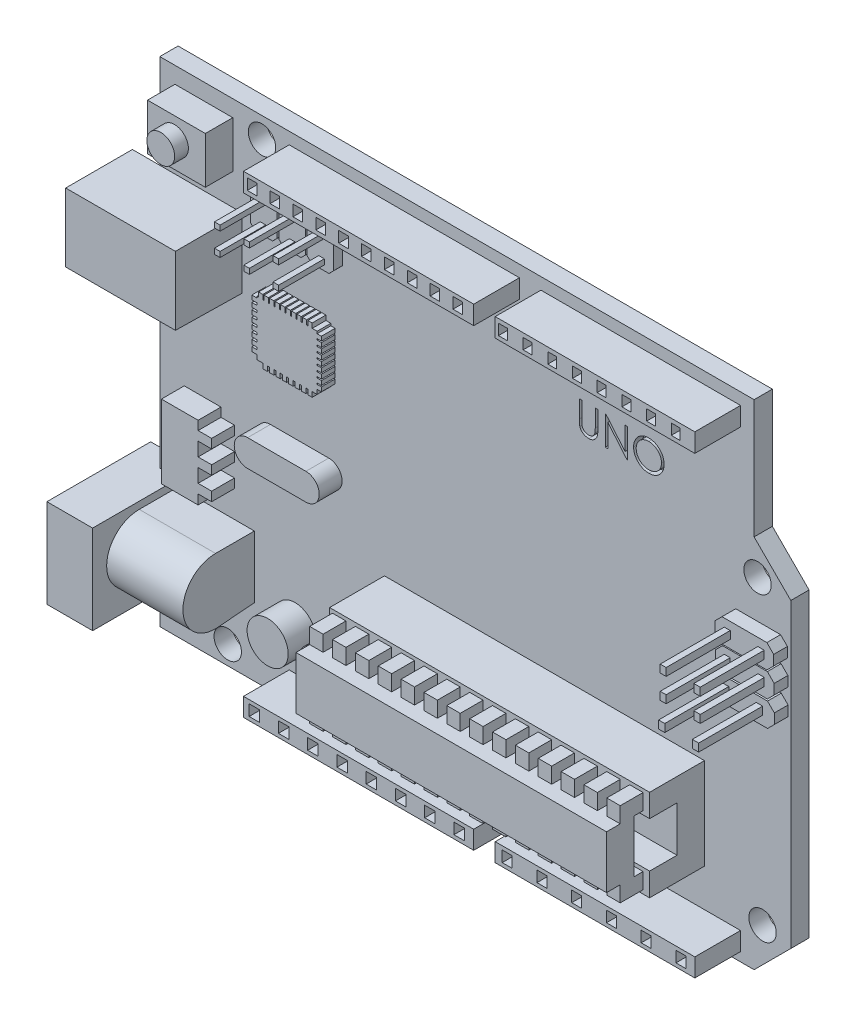
from build123d import *

# Parameters (mm, degrees)
BOSS_EXTRUDE1_DEPTH       = 2
SKETCH2_W                 = 25.178937016
SKETCH2_H                 = 2.043442087
SKETCH2_W_2               = 21.832565453
BOSS_EXTRUDE2_DEPTH       = 5
SKETCH3_W                 = 1.049746907
SKETCH3_H                 = 1.211246432
CUT_EXTRUDE1_DEPTH        = 5
SKETCH4_W                 = 0.97556606
SKETCH4_H                 = 1.178808989
CUT_EXTRUDE2_DEPTH        = 5
SKETCH5_W                 = 25.178937016
SKETCH5_H                 = 2
SKETCH5_W_2               = 21.832565453
BOSS_EXTRUDE3_DEPTH       = 5
SKETCH6_W                 = 1.138160402
SKETCH6_H                 = 1.2
CUT_EXTRUDE3_DEPTH        = 5
SKETCH7_W                 = 1.077432395
SKETCH7_H                 = 1.2
CUT_EXTRUDE4_DEPTH        = 5
SKETCH8_R                 = 1.5
CUT_EXTRUDE5_DEPTH        = 5
SKETCH9_W                 = 35
SKETCH9_H                 = 10
BOSS_EXTRUDE4_DEPTH       = 6
SKETCH10_W                = 2.996444985
SKETCH10_H                = 4.96379909
CUT_EXTRUDE7_DEPTH        = 35
SKETCH11_W                = 1.469225993
SKETCH11_H                = 1.721786389
CUT_EXTRUDE8_DEPTH        = 5
BOSS_EXTRUDE5_DEPTH       = 2.5
BOSS_EXTRUDE5_DEPTH_BACK  = 4
SKETCH12_W                = 1.469225993
SKETCH12_H                = 1.721786389
BOSS_EXTRUDE6_DEPTH       = 1.5
BOSS_EXTRUDE6_DEPTH_BACK  = 1.5
SKETCH14_W                = 33.969225993
SKETCH14_H                = 5.76399946
BOSS_EXTRUDE7_DEPTH       = 1.5
SKETCH16_W                = 0.697269988
SKETCH16_H                = 0.859966319
SKETCH16_W_2              = 0.674027655
SKETCH16_H_2              = 0.859966318
CUT_EXTRUDE9_DEPTH        = 0.7
BOSS_EXTRUDE8_DEPTH       = 7
BOSS_EXTRUDE8_DEPTH_BACK  = 0.7
SKETCH17_W                = 0.674027655
SKETCH17_H                = 0.859966319
SKETCH17_W_2              = 0.697269988
SKETCH17_W_3              = 0.649555692
SKETCH17_H_2              = 0.84214477
SKETCH17_H_3              = 0.870642791
BOSS_EXTRUDE9_DEPTH       = 1
SKETCH19_W                = 0.612883107
SKETCH19_H                = 0.582238952
BOSS_EXTRUDE10_DEPTH      = 5
BOSS_EXTRUDE11_DEPTH      = 2.5
SKETCH21_W                = 6.591002415
SKETCH21_H                = 5.991820376
BOSS_EXTRUDE12_DEPTH      = 1.5
SKETCH22_W                = 0.548805805
SKETCH22_H                = 0.464846659
SKETCH22_W_2              = 0.467458737
SKETCH22_H_2              = 0.53631011
SKETCH22_W_3              = 0.470164257
SKETCH22_H_3              = 0.517058878
BOSS_EXTRUDE13_DEPTH      = 1.5
SKETCH23_R                = 2.25
BOSS_EXTRUDE14_DEPTH      = 3
BOSS_EXTRUDE15_DEPTH      = 5
BOSS_EXTRUDE15_DEPTH_BACK = 7
BOSS_EXTRUDE16_DEPTH      = 3
BOSS_EXTRUDE16_DEPTH_BACK = 2
SKETCH26_W                = 11.348912623
SKETCH26_H                = 9.724183991
SKETCH27_R                = 2.838558078
CUT_EXTRUDE10_DEPTH       = 12
SKETCH28_R                = 0.677386971
BOSS_EXTRUDE17_DEPTH      = 9
BOSS_EXTRUDE18_DEPTH      = 3
BOSS_EXTRUDE18_DEPTH_BACK = 9
CUT_EXTRUDE11_DEPTH       = 11
SKETCH31_W                = 1.647750603
SKETCH31_H                = 2.696319169
BOSS_EXTRUDE19_DEPTH      = 10
SKETCH32_W                = 6.321988741
SKETCH32_H                = 5.098378018
BOSS_EXTRUDE20_DEPTH      = 3
SKETCH33_R                = 1.522317311
BOSS_EXTRUDE21_DEPTH      = 1.5
SKETCH34_W                = 4.013596682
SKETCH34_H                = 8.027193363
BOSS_EXTRUDE22_DEPTH      = 2.5
SKETCH35_W                = 1.481027251
SKETCH35_H                = 1.003309183
BOSS_EXTRUDE23_DEPTH      = 2.5
CUT_EXTRUDE12_DEPTH       = 1
SKETCH39_R                = 0.978088465
BOSS_EXTRUDE25_DEPTH      = 2
BOSS_EXTRUDE25_TAPER      = 26


with BuildPart() as part:
    # Sketch1 → Boss-Extrude1 (new body)
    with BuildSketch(Plane.XY):
        Polygon((-30.343249428, 34.812356979), (32.656750572, 34.812356979), (34.656750572, 34.812356979), (34.656750572, 21.812356979), (38.672768879, 17.796338673), (38.672768879, -15.171624714), (34.656750572, -19.187643021), (-30.343249428, -19.187643021), align=None)
    extrude(amount=BOSS_EXTRUDE1_DEPTH)

    # Sketch2 → Boss-Extrude2 (add)
    with BuildSketch(Plane.XY.offset(2)):
        with Locations((-3.601371659, 32.502868328)):
            Rectangle(SKETCH2_W, SKETCH2_H)
        with Locations((22.258135939, 32.502868328)):
            Rectangle(SKETCH2_W_2, SKETCH2_H)
    extrude(amount=BOSS_EXTRUDE2_DEPTH)

    # Sketch3 → Cut-Extrude1 (cut)
    with BuildSketch(Plane.XY.offset(7)):
        with Locations((-15.253340387, 32.52050598)):
            Rectangle(SKETCH3_W, SKETCH3_H)
        with Locations((-12.753340387, 32.52050598)):
            Rectangle(SKETCH3_W, SKETCH3_H)
        with Locations((-10.253340387, 32.52050598)):
            Rectangle(SKETCH3_W, SKETCH3_H)
        with Locations((-7.753340388, 32.52050598)):
            Rectangle(SKETCH3_W, SKETCH3_H)
        with Locations((-5.253340387, 32.52050598)):
            Rectangle(SKETCH3_W, SKETCH3_H)
        with Locations((-2.753340388, 32.52050598)):
            Rectangle(SKETCH3_W, SKETCH3_H)
        with Locations((-0.253340387, 32.52050598)):
            Rectangle(SKETCH3_W, SKETCH3_H)
        with Locations((2.246659613, 32.52050598)):
            Rectangle(SKETCH3_W, SKETCH3_H)
        with Locations((4.746659613, 32.52050598)):
            Rectangle(SKETCH3_W, SKETCH3_H)
        with Locations((7.246659613, 32.52050598)):
            Rectangle(SKETCH3_W, SKETCH3_H)
    extrude(amount=-CUT_EXTRUDE1_DEPTH, mode=Mode.SUBTRACT)

    # Sketch4 → Cut-Extrude2 (cut)
    with BuildSketch(Plane.XY.offset(7)):
        with Locations((12.184465787, 32.488032675)):
            Rectangle(SKETCH4_W, SKETCH4_H)
        with Locations((14.884465787, 32.488032675)):
            Rectangle(SKETCH4_W, SKETCH4_H)
        with Locations((17.584465787, 32.488032675)):
            Rectangle(SKETCH4_W, SKETCH4_H)
        with Locations((20.284465787, 32.488032675)):
            Rectangle(SKETCH4_W, SKETCH4_H)
        with Locations((22.984465787, 32.488032675)):
            Rectangle(SKETCH4_W, SKETCH4_H)
        with Locations((25.684465787, 32.488032675)):
            Rectangle(SKETCH4_W, SKETCH4_H)
        with Locations((28.384465787, 32.488032675)):
            Rectangle(SKETCH4_W, SKETCH4_H)
        with Locations((31.084465787, 32.488032675)):
            Rectangle(SKETCH4_W, SKETCH4_H)
    extrude(amount=-CUT_EXTRUDE2_DEPTH, mode=Mode.SUBTRACT)

    # Sketch5 → Boss-Extrude3 (add)
    with BuildSketch(Plane.XY.offset(2)):
        with Locations((-3.601371659, -17.212225696)):
            Rectangle(SKETCH5_W, SKETCH5_H)
        with Locations((22.258135939, -17.212225696)):
            Rectangle(SKETCH5_W_2, SKETCH5_H)
    extrude(amount=BOSS_EXTRUDE3_DEPTH)

    # Sketch6 → Cut-Extrude3 (cut)
    with BuildSketch(Plane.XY.offset(7)):
        with Locations((-15.002920658, -17.212225696)):
            Rectangle(SKETCH6_W, SKETCH6_H)
        with Locations((-11.802920658, -17.212225696)):
            Rectangle(SKETCH6_W, SKETCH6_H)
        with Locations((-8.602920658, -17.212225696)):
            Rectangle(SKETCH6_W, SKETCH6_H)
        with Locations((-5.402920658, -17.212225696)):
            Rectangle(SKETCH6_W, SKETCH6_H)
        with Locations((-2.202920658, -17.212225696)):
            Rectangle(SKETCH6_W, SKETCH6_H)
        with Locations((0.997079342, -17.212225696)):
            Rectangle(SKETCH6_W, SKETCH6_H)
        with Locations((4.197079342, -17.212225696)):
            Rectangle(SKETCH6_W, SKETCH6_H)
        with Locations((7.397079342, -17.212225696)):
            Rectangle(SKETCH6_W, SKETCH6_H)
    extrude(amount=-CUT_EXTRUDE3_DEPTH, mode=Mode.SUBTRACT)

    # Sketch7 → Cut-Extrude4 (cut)
    with BuildSketch(Plane.XY.offset(7)):
        with Locations((12.648591204, -17.212225696)):
            Rectangle(SKETCH7_W, SKETCH7_H)
        with Locations((16.448591204, -17.212225696)):
            Rectangle(SKETCH7_W, SKETCH7_H)
        with Locations((20.248591203, -17.212225696)):
            Rectangle(SKETCH7_W, SKETCH7_H)
        with Locations((24.048591204, -17.212225696)):
            Rectangle(SKETCH7_W, SKETCH7_H)
        with Locations((27.848591203, -17.212225696)):
            Rectangle(SKETCH7_W, SKETCH7_H)
        with Locations((31.648591204, -17.212225696)):
            Rectangle(SKETCH7_W, SKETCH7_H)
    extrude(amount=-CUT_EXTRUDE4_DEPTH, mode=Mode.SUBTRACT)

    # Sketch8 → Cut-Extrude5 (cut)
    with BuildSketch(Plane.XY.offset(2)):
        with Locations((35.033170291, 18.172758392)):
            Circle(SKETCH8_R)
        with Locations((35.581965837, -14.507173924)):
            Circle(SKETCH8_R)
        with Locations((-22.913180591, -17.128595339)):
            Circle(SKETCH8_R)
        with Locations((-19.168292856, 32.528616034)):
            Circle(SKETCH8_R)
    extrude(amount=-CUT_EXTRUDE5_DEPTH, mode=Mode.SUBTRACT)

    # Sketch9 → Boss-Extrude4 (add)
    with BuildSketch(Plane.XY.offset(2)):
        with Locations((11.729432951, -7.092296208)):
            Rectangle(SKETCH9_W, SKETCH9_H)
    extrude(amount=BOSS_EXTRUDE4_DEPTH)

    # Sketch10 → Cut-Extrude7 (cut)
    with BuildSketch(Plane(origin=(29.229432951, 0, 0), x_dir=(0, 0, -1), z_dir=(1, 0, 0))):
        with Locations((-6.501777507, -7.074195753)):
            Rectangle(SKETCH10_W, SKETCH10_H)
    extrude(amount=-CUT_EXTRUDE7_DEPTH, mode=Mode.SUBTRACT)

    # Sketch11 → Cut-Extrude8 (cut)
    with BuildSketch(Plane.XY.offset(8)):
        with Locations((-4.718608535, -3.331403014)):
            Rectangle(SKETCH11_W, SKETCH11_H)
        with Locations((-4.718608535, -10.817188863)):
            Rectangle(SKETCH11_W, SKETCH11_H)
        with Locations((-2.218608534, -3.331403014)):
            Rectangle(SKETCH11_W, SKETCH11_H)
        with Locations((-2.218608534, -10.817188863)):
            Rectangle(SKETCH11_W, SKETCH11_H)
        with Locations((0.281391466, -3.331403014)):
            Rectangle(SKETCH11_W, SKETCH11_H)
        with Locations((0.281391466, -10.817188863)):
            Rectangle(SKETCH11_W, SKETCH11_H)
        with Locations((2.781391466, -3.331403014)):
            Rectangle(SKETCH11_W, SKETCH11_H)
        with Locations((2.781391466, -10.817188863)):
            Rectangle(SKETCH11_W, SKETCH11_H)
        with Locations((5.281391466, -3.331403014)):
            Rectangle(SKETCH11_W, SKETCH11_H)
        with Locations((5.281391466, -10.817188863)):
            Rectangle(SKETCH11_W, SKETCH11_H)
        with Locations((7.781391466, -3.331403014)):
            Rectangle(SKETCH11_W, SKETCH11_H)
        with Locations((7.781391466, -10.817188863)):
            Rectangle(SKETCH11_W, SKETCH11_H)
        with Locations((10.281391466, -3.331403014)):
            Rectangle(SKETCH11_W, SKETCH11_H)
        with Locations((10.281391466, -10.817188863)):
            Rectangle(SKETCH11_W, SKETCH11_H)
        with Locations((12.781391466, -3.331403014)):
            Rectangle(SKETCH11_W, SKETCH11_H)
        with Locations((12.781391466, -10.817188863)):
            Rectangle(SKETCH11_W, SKETCH11_H)
        with Locations((15.281391466, -3.331403014)):
            Rectangle(SKETCH11_W, SKETCH11_H)
        with Locations((15.281391466, -10.817188863)):
            Rectangle(SKETCH11_W, SKETCH11_H)
        with Locations((17.781391466, -3.331403014)):
            Rectangle(SKETCH11_W, SKETCH11_H)
        with Locations((17.781391466, -10.817188863)):
            Rectangle(SKETCH11_W, SKETCH11_H)
        with Locations((20.281391466, -3.331403014)):
            Rectangle(SKETCH11_W, SKETCH11_H)
        with Locations((20.281391466, -10.817188863)):
            Rectangle(SKETCH11_W, SKETCH11_H)
        with Locations((22.781391466, -3.331403014)):
            Rectangle(SKETCH11_W, SKETCH11_H)
        with Locations((22.781391466, -10.817188863)):
            Rectangle(SKETCH11_W, SKETCH11_H)
        with Locations((25.281391466, -3.331403014)):
            Rectangle(SKETCH11_W, SKETCH11_H)
        with Locations((25.281391466, -10.817188863)):
            Rectangle(SKETCH11_W, SKETCH11_H)
        with Locations((27.781391466, -3.331403014)):
            Rectangle(SKETCH11_W, SKETCH11_H)
        with Locations((27.781391466, -10.817188863)):
            Rectangle(SKETCH11_W, SKETCH11_H)
    extrude(amount=-CUT_EXTRUDE8_DEPTH, mode=Mode.SUBTRACT)

    # Sketch12 → Boss-Extrude5 (add, two sides: drawn at the far end of the back side and taken through both)
    with BuildSketch(Plane.XY.offset(8).offset(-BOSS_EXTRUDE5_DEPTH_BACK)):
        with Locations((-4.718608535, -3.331403014)):
            Rectangle(SKETCH12_W, SKETCH12_H)
        with Locations((-4.718608535, -10.817188863)):
            Rectangle(SKETCH12_W, SKETCH12_H)
        with Locations((-2.218608534, -3.331403014)):
            Rectangle(SKETCH12_W, SKETCH12_H)
        with Locations((-2.218608534, -10.817188863)):
            Rectangle(SKETCH12_W, SKETCH12_H)
        with Locations((0.281391466, -3.331403014)):
            Rectangle(SKETCH12_W, SKETCH12_H)
        with Locations((0.281391466, -10.817188863)):
            Rectangle(SKETCH12_W, SKETCH12_H)
        with Locations((2.781391466, -3.331403014)):
            Rectangle(SKETCH12_W, SKETCH12_H)
        with Locations((2.781391466, -10.817188863)):
            Rectangle(SKETCH12_W, SKETCH12_H)
        with Locations((5.281391466, -3.331403014)):
            Rectangle(SKETCH12_W, SKETCH12_H)
        with Locations((5.281391466, -10.817188863)):
            Rectangle(SKETCH12_W, SKETCH12_H)
        with Locations((7.781391466, -3.331403014)):
            Rectangle(SKETCH12_W, SKETCH12_H)
        with Locations((7.781391466, -10.817188863)):
            Rectangle(SKETCH12_W, SKETCH12_H)
        with Locations((10.281391466, -3.331403014)):
            Rectangle(SKETCH12_W, SKETCH12_H)
        with Locations((10.281391466, -10.817188863)):
            Rectangle(SKETCH12_W, SKETCH12_H)
        with Locations((12.781391466, -3.331403014)):
            Rectangle(SKETCH12_W, SKETCH12_H)
        with Locations((12.781391466, -10.817188863)):
            Rectangle(SKETCH12_W, SKETCH12_H)
        with Locations((15.281391466, -3.331403014)):
            Rectangle(SKETCH12_W, SKETCH12_H)
        with Locations((15.281391466, -10.817188863)):
            Rectangle(SKETCH12_W, SKETCH12_H)
        with Locations((17.781391466, -3.331403014)):
            Rectangle(SKETCH12_W, SKETCH12_H)
        with Locations((17.781391466, -10.817188863)):
            Rectangle(SKETCH12_W, SKETCH12_H)
        with Locations((20.281391466, -3.331403014)):
            Rectangle(SKETCH12_W, SKETCH12_H)
        with Locations((20.281391466, -10.817188863)):
            Rectangle(SKETCH12_W, SKETCH12_H)
        with Locations((22.781391466, -3.331403014)):
            Rectangle(SKETCH12_W, SKETCH12_H)
        with Locations((22.781391466, -10.817188863)):
            Rectangle(SKETCH12_W, SKETCH12_H)
        with Locations((25.281391466, -3.331403014)):
            Rectangle(SKETCH12_W, SKETCH12_H)
        with Locations((25.281391466, -10.817188863)):
            Rectangle(SKETCH12_W, SKETCH12_H)
        with Locations((27.781391466, -3.331403014)):
            Rectangle(SKETCH12_W, SKETCH12_H)
        with Locations((27.781391466, -10.817188863)):
            Rectangle(SKETCH12_W, SKETCH12_H)
    extrude(amount=BOSS_EXTRUDE5_DEPTH + BOSS_EXTRUDE5_DEPTH_BACK)

    # Sketch14 → Boss-Extrude6 (add, two sides: drawn at the far end of the back side and taken through both)
    with BuildSketch(Plane.XY.offset(10.5).offset(-BOSS_EXTRUDE6_DEPTH_BACK)):
        with Locations((11.531391466, -7.074295938)):
            Rectangle(SKETCH14_W, SKETCH14_H)
    extrude(amount=BOSS_EXTRUDE6_DEPTH + BOSS_EXTRUDE6_DEPTH_BACK)

    # Sketch15 → Boss-Extrude7 (add)
    with BuildSketch(Plane.XY.offset(2)):
        Polygon((32.648796449, 14.001905849), (37.554364321, 14.001905849), (38.30086378, 13.25540639), (38.30086378, 12.153430998), (37.554364321, 11.40693154), (32.648796449, 11.40693154), (31.902296991, 12.153430998), (31.902296991, 13.25540639), align=None)
        Polygon((31.95745647, 9.432230003), (31.95745647, 10.534205394), (32.703955929, 11.280704853), (37.609523801, 11.280704853), (38.356023259, 10.534205394), (38.356023259, 9.432230003), (37.609523801, 8.685730544), (32.703955929, 8.685730544), align=None)
        Polygon((37.627997507, 8.494934517), (38.374496966, 7.748435058), (38.374496966, 6.646459667), (37.627997507, 5.899960208), (32.722429635, 5.899960208), (31.975930177, 6.646459667), (31.975930177, 7.748435058), (32.722429635, 8.494934517), align=None)
    extrude(amount=BOSS_EXTRUDE7_DEPTH)

    # Sketch16 → Cut-Extrude9 (cut)
    with BuildSketch(Plane.XY.offset(3.5)):
        with Locations((36.906767375, 10.134489985)):
            Rectangle(SKETCH16_W, SKETCH16_H)
        with Locations((33.219368171, 12.701903015)):
            Rectangle(SKETCH16_W_2, SKETCH16_H_2)
        with Locations((36.914899108, 12.701903015)):
            Rectangle(SKETCH16_W, SKETCH16_H_2)
        with Locations((33.211236438, 10.134489985)):
            Rectangle(SKETCH16_W_2, SKETCH16_H)
        with Locations((36.746215115, 7.322494267)):
            Rectangle(SKETCH16_W, SKETCH16_H)
        with Locations((33.050684178, 7.322494267)):
            Rectangle(SKETCH16_W_2, SKETCH16_H)
    extrude(amount=-CUT_EXTRUDE9_DEPTH, mode=Mode.SUBTRACT)

    # Sketch17 → Boss-Extrude8 (add, two sides: drawn at the far end of the back side and taken through both)
    with BuildSketch(Plane.XY.offset(3.5).offset(-BOSS_EXTRUDE8_DEPTH_BACK)):
        with Locations((33.050684178, 7.322494267)):
            Rectangle(SKETCH17_W, SKETCH17_H)
        with Locations((36.746215115, 7.322494267)):
            Rectangle(SKETCH17_W_2, SKETCH17_H)
        with Locations((36.91930074, 10.120952765)):
            Rectangle(SKETCH17_W_2, SKETCH17_H)
        with Locations((33.211533821, 10.120952765)):
            Rectangle(SKETCH17_W_3, SKETCH17_H)
        with Locations((33.211533821, 12.706904035)):
            Rectangle(SKETCH17_W_3, SKETCH17_H_2)
        with Locations((36.91930074, 12.700598239)):
            Rectangle(SKETCH17_W_2, SKETCH17_H_3)
    extrude(amount=BOSS_EXTRUDE8_DEPTH + BOSS_EXTRUDE8_DEPTH_BACK)

    # Sketch18 → Boss-Extrude9 (add)
    with BuildSketch(Plane.XY.offset(2)):
        Polygon((-18.835236403, 28.604565204), (-17.111655926, 28.604565204), (-16.517073728, 28.016389961), (-16.517073728, 25.003042012), (-17.00436299, 24.510444738), (-18.893844337, 24.510444738), (-19.417073728, 25.028036039), (-19.417073728, 28.016389961), align=None)
        Polygon((-15.725202743, 28.590242596), (-14.001622266, 28.590242596), (-13.407040068, 28.002067354), (-13.407040068, 24.988719404), (-13.89432933, 24.496122131), (-15.783810676, 24.496122131), (-16.307040068, 25.013713432), (-16.307040068, 28.002067354), align=None)
        Polygon((-12.675606392, 28.604565204), (-10.952025915, 28.604565204), (-10.357443717, 28.016389961), (-10.357443717, 25.003042012), (-10.844732979, 24.510444738), (-12.734214326, 24.510444738), (-13.257443717, 25.028036039), (-13.257443717, 28.016389961), align=None)
    extrude(amount=BOSS_EXTRUDE9_DEPTH)

    # Sketch19 → Boss-Extrude10 (add)
    with BuildSketch(Plane.XY.offset(3)):
        with Locations((-18.055934941, 25.361258481)):
            Rectangle(SKETCH19_W, SKETCH19_H)
        with Locations((-18.055934941, 27.858757142)):
            Rectangle(SKETCH19_W, SKETCH19_H)
        with Locations((-14.85593494, 27.858757142)):
            Rectangle(SKETCH19_W, SKETCH19_H)
        with Locations((-14.85593494, 25.361258481)):
            Rectangle(SKETCH19_W, SKETCH19_H)
        with Locations((-11.65593494, 27.858757142)):
            Rectangle(SKETCH19_W, SKETCH19_H)
        with Locations((-11.65593494, 25.361258481)):
            Rectangle(SKETCH19_W, SKETCH19_H)
    extrude(amount=BOSS_EXTRUDE10_DEPTH)

    # Sketch20 → Boss-Extrude11 (add)
    with BuildSketch(Plane.XY.offset(2)):
        with BuildLine():
            Line((-18.242145427, 6.015306116), (-11.866132062, 6.015306116))
            ThreePointArc((-11.866132062, 6.015306116), (-10.404962333, 4.554136386), (-11.866132062, 3.092966657))
            Line((-11.866132062, 3.092966657), (-18.242145427, 3.092966657))
            ThreePointArc((-18.242145427, 3.092966657), (-19.703315156, 4.554136386), (-18.242145427, 6.015306116))
        make_face()
    extrude(amount=BOSS_EXTRUDE11_DEPTH)

    # Sketch21 → Boss-Extrude12 (add)
    with BuildSketch(Plane.XY.offset(2)):
        with Locations((-14.934167726, 15.901314488)):
            Rectangle(SKETCH21_W, SKETCH21_H)
    extrude(amount=BOSS_EXTRUDE12_DEPTH)

    # Sketch22 → Boss-Extrude13 (add)
    with BuildSketch(Plane.XY.offset(3.5)):
        with Locations((-18.504071835, 18.526676124)):
            Rectangle(SKETCH22_W, SKETCH22_H)
        with Locations((-18.504071835, 17.826676124)):
            Rectangle(SKETCH22_W, SKETCH22_H)
        with Locations((-18.504071835, 17.126676124)):
            Rectangle(SKETCH22_W, SKETCH22_H)
        with Locations((-18.504071835, 16.426676124)):
            Rectangle(SKETCH22_W, SKETCH22_H)
        with Locations((-18.504071835, 15.726676124)):
            Rectangle(SKETCH22_W, SKETCH22_H)
        with Locations((-18.504071835, 15.026676123)):
            Rectangle(SKETCH22_W, SKETCH22_H)
        with Locations((-18.504071835, 14.326676124)):
            Rectangle(SKETCH22_W, SKETCH22_H)
        with Locations((-18.504071835, 13.626676124)):
            Rectangle(SKETCH22_W, SKETCH22_H)
        with Locations((-17.308395783, 12.637249245)):
            Rectangle(SKETCH22_W_2, SKETCH22_H_2)
        with Locations((-16.608395784, 12.637249245)):
            Rectangle(SKETCH22_W_2, SKETCH22_H_2)
        with Locations((-15.908395784, 12.637249245)):
            Rectangle(SKETCH22_W_2, SKETCH22_H_2)
        with Locations((-15.208395784, 12.637249245)):
            Rectangle(SKETCH22_W_2, SKETCH22_H_2)
        with Locations((-14.508395784, 12.637249245)):
            Rectangle(SKETCH22_W_2, SKETCH22_H_2)
        with Locations((-13.808395783, 12.637249245)):
            Rectangle(SKETCH22_W_2, SKETCH22_H_2)
        with Locations((-13.108395784, 12.637249245)):
            Rectangle(SKETCH22_W_2, SKETCH22_H_2)
        with Locations((-11.40358439, 13.626676124)):
            Rectangle(SKETCH22_W_3, SKETCH22_H)
        with Locations((-11.40358439, 14.226676124)):
            Rectangle(SKETCH22_W_3, SKETCH22_H)
        with Locations((-11.40358439, 14.826676124)):
            Rectangle(SKETCH22_W_3, SKETCH22_H)
        with Locations((-11.40358439, 15.426676124)):
            Rectangle(SKETCH22_W_3, SKETCH22_H)
        with Locations((-11.40358439, 16.026676123)):
            Rectangle(SKETCH22_W_3, SKETCH22_H)
        with Locations((-11.40358439, 16.626676124)):
            Rectangle(SKETCH22_W_3, SKETCH22_H)
        with Locations((-11.40358439, 17.826676124)):
            Rectangle(SKETCH22_W_3, SKETCH22_H)
        with Locations((-11.40358439, 18.426676124)):
            Rectangle(SKETCH22_W_3, SKETCH22_H)
        with Locations((-13.008395784, 19.155754115)):
            Rectangle(SKETCH22_W_2, SKETCH22_H_3)
        with Locations((-13.608395784, 19.155754115)):
            Rectangle(SKETCH22_W_2, SKETCH22_H_3)
        with Locations((-14.808395783, 19.155754115)):
            Rectangle(SKETCH22_W_2, SKETCH22_H_3)
        with Locations((-15.408395784, 19.155754115)):
            Rectangle(SKETCH22_W_2, SKETCH22_H_3)
        with Locations((-16.008395783, 19.155754115)):
            Rectangle(SKETCH22_W_2, SKETCH22_H_3)
        with Locations((-16.608395784, 19.155754115)):
            Rectangle(SKETCH22_W_2, SKETCH22_H_3)
        with Locations((-17.208395784, 19.155754115)):
            Rectangle(SKETCH22_W_2, SKETCH22_H_3)
        with Locations((-17.808395783, 19.155754115)):
            Rectangle(SKETCH22_W_2, SKETCH22_H_3)
        with Locations((-12.408395784, 12.637249245)):
            Rectangle(SKETCH22_W_2, SKETCH22_H_2)
        with Locations((-11.40358439, 17.226676123)):
            Rectangle(SKETCH22_W_3, SKETCH22_H)
        with Locations((-12.408395784, 19.155754115)):
            Rectangle(SKETCH22_W_2, SKETCH22_H_3)
        with Locations((-14.208395784, 19.155754115)):
            Rectangle(SKETCH22_W_2, SKETCH22_H_3)
    extrude(amount=-BOSS_EXTRUDE13_DEPTH)

    # Sketch23 → Boss-Extrude14 (add)
    with BuildSketch(Plane.XY.offset(2)):
        with Locations((-15.547522044, -11.757884034)):
            Circle(SKETCH23_R)
        with Locations((-9.964370412, -11.757884034)):
            Circle(SKETCH23_R)
    extrude(amount=BOSS_EXTRUDE14_DEPTH)

    # Sketch24 → Boss-Extrude15 (add, two sides: drawn at the far end of the back side and taken through both)
    with BuildSketch(Plane(origin=(-25, 0, 0), x_dir=(0, 0, -1), z_dir=(1, 0, 0)).offset(-BOSS_EXTRUDE15_DEPTH_BACK)):
        with BuildLine():
            Line((-2, -4.957710199), (-6.247162591, -4.957710199))
            ThreePointArc((-6.247162591, -4.957710199), (-9.814455595, -8.525003203), (-6.247162591, -12.092296208))
            Line((-6.247162591, -12.092296208), (-2, -11.757884034))
            Line((-2, -11.757884034), (-2, -4.957710199))
        make_face()
    extrude(amount=BOSS_EXTRUDE15_DEPTH + BOSS_EXTRUDE15_DEPTH_BACK)

    # Sketch26 → Boss-Extrude16 (add, two sides: drawn at the far end of the back side and taken through both)
    with BuildSketch(Plane.ZY.offset(30.343249428).offset(-BOSS_EXTRUDE16_DEPTH_BACK)):
        with Locations((5.674456312, -9.03941534)):
            Rectangle(SKETCH26_W, SKETCH26_H)
    extrude(amount=BOSS_EXTRUDE16_DEPTH + BOSS_EXTRUDE16_DEPTH_BACK)

    # Sketch27 → Cut-Extrude10 (cut)
    with BuildSketch(Plane.ZY.offset(33.343249428)):
        with Locations(Location((5.625511226, -8.740046811, 0), (0, 0, 270))):
            Circle(SKETCH27_R)
    extrude(amount=-CUT_EXTRUDE10_DEPTH, mode=Mode.SUBTRACT)

    # Sketch28 → Boss-Extrude17 (add)
    with BuildSketch(Plane.ZY.offset(21.343249428)):
        with Locations(Location((5.625511226, -8.740046811, 0), (0, 0, 270))):
            Circle(SKETCH28_R)
    extrude(amount=BOSS_EXTRUDE17_DEPTH)

    # Sketch29 → Boss-Extrude18 (add, two sides: drawn at the far end of the back side and taken through both)
    with BuildSketch(Plane.ZY.offset(30.343249428).offset(-BOSS_EXTRUDE18_DEPTH_BACK)):
        Polygon((2, 24.510444738), (9.295501207, 24.510444738), (9.295501207, 17.024780809), (2, 16.894252794), align=None)
    extrude(amount=BOSS_EXTRUDE18_DEPTH + BOSS_EXTRUDE18_DEPTH_BACK)

    # Sketch30 → Cut-Extrude11 (cut)
    with BuildSketch(Plane.ZY.offset(33.343249428)):
        Polygon((3.30368083, 23.016601186), (6.374488774, 23.016601186), (8.097137132, 21.96803262), (8.097137132, 18.822326922), (6.374488774, 17.848656111), (3.30368083, 17.848656111), align=None)
    extrude(amount=-CUT_EXTRUDE11_DEPTH, mode=Mode.SUBTRACT)

    # Sketch31 → Boss-Extrude19 (add)
    with BuildSketch(Plane.ZY.offset(22.343249428)):
        with Locations((5.325920208, 20.470077526)):
            Rectangle(SKETCH31_W, SKETCH31_H)
    extrude(amount=BOSS_EXTRUDE19_DEPTH)

    # Sketch32 → Boss-Extrude20 (add)
    with BuildSketch(Plane.XY.offset(2)):
        with Locations((-25.525277343, 30.465872101)):
            Rectangle(SKETCH32_W, SKETCH32_H)
    extrude(amount=BOSS_EXTRUDE20_DEPTH)

    # Sketch33 → Boss-Extrude21 (add)
    with BuildSketch(Plane.XY.offset(5)):
        with Locations((-25.739155252, 30.658984244)):
            Circle(SKETCH33_R)
    extrude(amount=BOSS_EXTRUDE21_DEPTH)

    # Sketch34 → Boss-Extrude22 (add)
    with BuildSketch(Plane.XY.offset(2)):
        with Locations((-25.6619707, 0.94293189)):
            Rectangle(SKETCH34_W, SKETCH34_H)
    extrude(amount=BOSS_EXTRUDE22_DEPTH)

    # Sketch35 → Boss-Extrude23 (add)
    with BuildSketch(Plane.XY.offset(4.5)):
        with Locations((-22.914658734, 3.478764566)):
            Rectangle(SKETCH35_W, SKETCH35_H)
        with Locations((-22.914658734, 0.978764566)):
            Rectangle(SKETCH35_W, SKETCH35_H)
        with Locations((-22.914658734, -1.521235435)):
            Rectangle(SKETCH35_W, SKETCH35_H)
    extrude(amount=-BOSS_EXTRUDE23_DEPTH)

    # Sketch36 → Cut-Extrude12 (cut)
    # profile 1 of 3: a face of its own
    with BuildSketch(Plane.XY.offset(2)):
        with BuildLine():
            Line((15.53488896, 25.344380581), (15.819824857, 25.344380581))
            Line((15.819824857, 25.344380581), (15.819824857, 23.442051855))
            add(Edge.make_bspline(
                [(15.819824857, 23.442051855), (15.819782454, 23.415127187), (15.819701986, 23.364032991), (15.82023948, 23.29130889), (15.821744765, 23.226654588), (15.822693781, 23.169820865), (15.824805005, 23.121068516), (15.826526805, 23.080133413), (15.828740738, 23.047209386), (15.831401495, 23.02799526), (15.83254521, 23.01973615)],
                knots=[0, 0, 0, 0, 1.528628734, 2.90083645, 4.128790002, 5.200304208, 6.127813768, 6.898992206, 7.526736466, 8, 8, 8, 8], degree=3))
            add(Edge.make_bspline(
                [(15.83254521, 23.01973615), (15.837241904, 22.989939443), (15.846370652, 22.932024967), (15.86963558, 22.849558169), (15.902127171, 22.775234632), (15.940629074, 22.706735103), (15.991367943, 22.645966184), (16.052149721, 22.589984899), (16.125789554, 22.541024762), (16.207668818, 22.496256525), (16.295920426, 22.460274629), (16.386100646, 22.433066363), (16.47685392, 22.41648479), (16.53761087, 22.414564786), (16.567781588, 22.41361135)],
                knots=[0, 0, 0, 0, 1.035780045, 2.013197591, 2.933192213, 3.817615948, 4.702609284, 5.640816605, 6.646850145, 7.73207398, 8.84249596, 9.914020372, 10.964143139, 12, 12, 12, 12], degree=3))
            add(Edge.make_bspline(
                [(16.567781588, 22.41361135), (16.593683909, 22.414585486), (16.645338948, 22.416528131), (16.722089067, 22.428558143), (16.796837737, 22.45023937), (16.869954068, 22.478215437), (16.938489604, 22.515179323), (17.002482583, 22.557879299), (17.059599867, 22.607963451), (17.111722479, 22.663390192), (17.157111314, 22.725928439), (17.196455135, 22.794216464), (17.228682228, 22.869281943), (17.244596712, 22.922036312), (17.252772573, 22.949138193)],
                knots=[0, 0, 0, 0, 0.994687771, 1.983630487, 2.973142513, 3.978332533, 4.983357753, 5.956394766, 6.925816176, 7.893390482, 8.871859704, 9.88551698, 10.913711441, 12, 12, 12, 12], degree=3))
            add(Edge.make_bspline(
                [(17.252772573, 22.949138193), (17.255494116, 22.960340114), (17.261558809, 22.985302508), (17.267225771, 23.027503965), (17.273128119, 23.077296459), (17.277223479, 23.135037747), (17.281216014, 23.200534343), (17.283604588, 23.274127448), (17.28470861, 23.355549834), (17.285037613, 23.412370688), (17.285209472, 23.442051855)],
                knots=[0, 0, 0, 0, 0.558680831, 1.244966039, 2.062412453, 2.990489873, 4.051219941, 5.244515665, 6.560634259, 8, 8, 8, 8], degree=3))
            Line((17.285209472, 23.442051855), (17.285209472, 25.344380581))
            Line((17.285209472, 25.344380581), (17.57014537, 25.344380581))
            Line((17.57014537, 25.344380581), (17.57014537, 23.426787432))
            add(Edge.make_bspline(
                [(17.57014537, 23.426787432), (17.569914846, 23.39222676), (17.569464966, 23.324779506), (17.565563729, 23.225945059), (17.55934345, 23.13218914), (17.55055497, 23.043499147), (17.538909975, 22.960192445), (17.52596031, 22.881538834), (17.509468877, 22.808102905), (17.490207148, 22.739312069), (17.468187573, 22.673829496), (17.43966596, 22.611682396), (17.407530878, 22.550981476), (17.369417585, 22.492644835), (17.326590117, 22.436414176), (17.278101806, 22.382630515), (17.225556318, 22.33043438), (17.168080146, 22.28116467), (17.106620741, 22.235981084), (17.041360922, 22.196250249), (16.972801995, 22.162664539), (16.901122173, 22.135018522), (16.826290868, 22.114231707), (16.748306192, 22.098742101), (16.666990638, 22.089940732), (16.611686985, 22.088632695), (16.583682029, 22.087970324)],
                knots=[0, 0, 0, 0, 1.316592851, 2.569410997, 3.76748051, 4.895814652, 5.963796859, 6.97159953, 7.931736103, 8.829262218, 9.692595152, 10.560224239, 11.431080259, 12.30701507, 13.211635791, 14.121146779, 15.063487852, 16.031507147, 17.00238618, 17.966455255, 18.938106653, 19.907068911, 20.888905087, 21.893141452, 22.933117798, 24, 24, 24, 24], degree=3))
            add(Edge.make_bspline(
                [(16.583682029, 22.087970324), (16.553139343, 22.088682219), (16.493214702, 22.090078953), (16.40491517, 22.098082447), (16.320265863, 22.113157705), (16.238372746, 22.132352797), (16.160350752, 22.158826616), (16.085154556, 22.189758486), (16.014072038, 22.227747144), (15.945950029, 22.270014007), (15.882609, 22.317570643), (15.824463499, 22.369404944), (15.77141753, 22.424686572), (15.724365213, 22.484014047), (15.682526982, 22.546925952), (15.646486003, 22.613600263), (15.615540417, 22.684011164), (15.599568745, 22.732954424), (15.591494529, 22.757696887)],
                knots=[0, 0, 0, 0, 1.13879206, 2.234305948, 3.301075583, 4.341971843, 5.366689343, 6.369221514, 7.369726634, 8.367512178, 9.355451585, 10.318319045, 11.268648973, 12.207971039, 13.137398894, 14.081662264, 15.030215811, 16, 16, 16, 16], degree=3))
            add(Edge.make_bspline(
                [(15.591494529, 22.757696887), (15.586798106, 22.774599294), (15.576611462, 22.811260991), (15.5657028, 22.871936591), (15.556532418, 22.941800123), (15.547909519, 23.02085637), (15.542821393, 23.109166606), (15.538360574, 23.206692551), (15.534857534, 23.313552131), (15.534878192, 23.387987299), (15.53488896, 23.426787432)],
                knots=[0, 0, 0, 0, 0.625038921, 1.35572334, 2.194682327, 3.136881307, 4.189498639, 5.346923369, 6.617055217, 8, 8, 8, 8], degree=3))
            Line((15.53488896, 23.426787432), (15.53488896, 25.344380581))
        make_face()
    # profile 2 of 3: a face of its own
    with BuildSketch(Plane.XY.offset(2)):
        Polygon((18.384247934, 22.169380581), (18.384247934, 25.344380581), (18.444033591, 25.344380581), (20.541619729, 22.84546732), (20.541619729, 25.344380581), (20.826555626, 25.344380581), (20.826555626, 22.169380581), (20.761681828, 22.169380581), (18.669183831, 24.662569683), (18.669183831, 22.169380581), align=None)
    # profile 3 of 3: a face of its own
    with BuildSketch(Plane.XY.offset(2)):
        with BuildLine():
            add(Edge.make_bspline(
                [(23.12639537, 25.425790837), (23.18518558, 25.424301781), (23.300654404, 25.421377152), (23.470358061, 25.398989679), (23.632369326, 25.360258861), (23.788007952, 25.308676013), (23.935412295, 25.239865249), (24.075691862, 25.156693721), (24.208512883, 25.058290077), (24.332085136, 24.945414992), (24.445166798, 24.822602859), (24.544794567, 24.691540755), (24.628290076, 24.553021127), (24.696857183, 24.407460231), (24.750649493, 24.25518726), (24.787768911, 24.095390414), (24.811479947, 23.92910506), (24.814251974, 23.815687833), (24.81565819, 23.758152616)],
                knots=[0, 0, 0, 0, 1.065120563, 2.091984664, 3.0946048, 4.079830382, 5.057816894, 6.036188127, 7.030412546, 8.04752943, 9.064399622, 10.05169764, 11.02544977, 11.989514704, 12.962713494, 13.945757189, 14.957906945, 16, 16, 16, 16], degree=3))
            add(Edge.make_bspline(
                [(24.81565819, 23.758152616), (24.81425218, 23.701041218), (24.811480771, 23.588468037), (24.787741952, 23.423237913), (24.750511902, 23.264405638), (24.697356717, 23.112236367), (24.629116462, 22.966569577), (24.545064985, 22.827788555), (24.446058315, 22.695847803), (24.333384958, 22.572192742), (24.21055687, 22.458802179), (24.07881227, 22.359997199), (23.941114044, 22.274976029), (23.795690238, 22.207136553), (23.64446949, 22.152914883), (23.486098383, 22.115946426), (23.321319009, 22.092100322), (23.208950312, 22.089362097), (23.151836075, 22.087970324)],
                knots=[0, 0, 0, 0, 1.043624062, 2.057103931, 3.04512605, 4.022047818, 4.998200453, 5.980619268, 6.982898556, 8.009068085, 9.034988726, 10.034168286, 11.015286542, 11.987931943, 12.962482838, 13.94673481, 14.956375938, 16, 16, 16, 16], degree=3))
            add(Edge.make_bspline(
                [(23.151836075, 22.087970324), (23.094301157, 22.08937584), (22.980884518, 22.092146484), (22.814390208, 22.115896759), (22.654481111, 22.15303637), (22.501614521, 22.206112787), (22.355705192, 22.274708418), (22.21646776, 22.358350962), (22.084461105, 22.457598868), (21.960779664, 22.57023569), (21.84761432, 22.692855597), (21.748954029, 22.824240957), (21.665292676, 22.961814122), (21.596927367, 23.105956876), (21.542803179, 23.255972399), (21.505878094, 23.412861375), (21.481987623, 23.575729355), (21.479234584, 23.686621127), (21.477837678, 23.742888193)],
                knots=[0, 0, 0, 0, 1.053102029, 2.075944431, 3.073151272, 4.055350789, 5.033113405, 6.020478099, 7.024410459, 8.052272461, 9.079885166, 10.07527673, 11.055994387, 12.023226415, 12.992069828, 13.970394897, 14.97016774, 16, 16, 16, 16], degree=3))
            add(Edge.make_bspline(
                [(21.477837678, 23.742888193), (21.478322668, 23.780654971), (21.479286532, 23.855712084), (21.490890424, 23.967169642), (21.507728539, 24.076834739), (21.531860274, 24.184395527), (21.563421286, 24.289588706), (21.600661339, 24.393139756), (21.646145342, 24.493999276), (21.697562787, 24.592645067), (21.754950284, 24.687539382), (21.818337571, 24.77723729), (21.885498227, 24.86249148), (21.95912502, 24.94109269), (22.036791366, 25.015327507), (22.119757181, 25.084055115), (22.207516217, 25.147895249), (22.30044609, 25.205426558), (22.396256953, 25.257459487), (22.495023745, 25.302110738), (22.595405063, 25.340433951), (22.697871065, 25.371495271), (22.802149651, 25.396017189), (22.908468413, 25.412715289), (23.01674265, 25.424348777), (23.089687203, 25.425308082), (23.12639537, 25.425790837)],
                knots=[0, 0, 0, 0, 1.037015668, 2.060948919, 3.074880161, 4.083647147, 5.086022904, 6.090072063, 7.104153813, 8.122640571, 9.144368836, 10.147691507, 11.138137339, 12.123020368, 13.103399296, 14.087645067, 15.080126199, 16.082011238, 17.087798457, 18.072939717, 19.057185487, 20.037253025, 21.01195951, 21.997135196, 22.992090687, 24, 24, 24, 24], degree=3))
        make_face()
        with BuildLine():
            add(Edge.make_bspline(
                [(23.140387758, 25.100149812), (23.11025734, 25.099782518), (23.050284554, 25.099051443), (22.961126439, 25.089421473), (22.873140899, 25.075696502), (22.786309763, 25.056118979), (22.700996344, 25.029445303), (22.616405416, 24.998746765), (22.53330836, 24.961353347), (22.451979503, 24.919105251), (22.373135114, 24.872343016), (22.298737877, 24.820661484), (22.228595193, 24.765272653), (22.162878801, 24.706047257), (22.101781667, 24.64268369), (22.044101259, 24.576142552), (21.992149567, 24.504521907), (21.944537651, 24.429763896), (21.90193111, 24.35196589), (21.864043967, 24.271946943), (21.83305233, 24.189054327), (21.807777175, 24.104187342), (21.786822346, 24.017480396), (21.773547286, 23.928275733), (21.763811503, 23.837021596), (21.763122215, 23.775352343), (21.762773575, 23.744160228)],
                knots=[0, 0, 0, 0, 1.008559885, 2.007477868, 2.99961109, 3.989939068, 4.984837346, 5.991145699, 7.001802488, 8.033829008, 9.059044045, 10.069351652, 11.065060232, 12.050310815, 13.029377138, 14.011219647, 14.996725999, 15.989392538, 16.977580475, 17.965360261, 18.951710183, 19.937753436, 20.929683414, 21.935841486, 22.955955122, 24, 24, 24, 24], degree=3))
            add(Edge.make_bspline(
                [(21.762773575, 23.744160228), (21.763930057, 23.698293071), (21.766205215, 23.608058183), (21.786123868, 23.475825652), (21.81680523, 23.348745564), (21.862032984, 23.22751326), (21.918593899, 23.111086661), (21.988468292, 23.000498595), (22.07125332, 22.895719173), (22.165290947, 22.797479893), (22.268090831, 22.707812628), (22.377249808, 22.629105821), (22.491598437, 22.562512238), (22.611434914, 22.508260493), (22.736119467, 22.465271231), (22.866455531, 22.435808473), (23.001574877, 22.416417881), (23.093677685, 22.414555739), (23.140387758, 22.41361135)],
                knots=[0, 0, 0, 0, 1.032063989, 2.030389145, 3.003944642, 3.970395727, 4.937377036, 5.913328081, 6.909231446, 7.93887556, 8.970685674, 9.976071282, 10.964166581, 11.944589148, 12.933237628, 13.927779006, 14.949070134, 16, 16, 16, 16], degree=3))
            add(Edge.make_bspline(
                [(23.140387758, 22.41361135), (23.17178352, 22.414042701), (23.234050746, 22.414898198), (23.32666597, 22.423514855), (23.417612676, 22.437332336), (23.506763301, 22.457226574), (23.594016666, 22.482125111), (23.679736952, 22.511704979), (23.763011115, 22.548608642), (23.844889682, 22.589382855), (23.923263416, 22.635864998), (23.998080506, 22.685792462), (24.067455144, 22.741099711), (24.133122374, 22.799445155), (24.194470349, 22.862005217), (24.251084213, 22.928698562), (24.302773333, 22.999946158), (24.350367169, 23.074590776), (24.392824415, 23.152601662), (24.429816883, 23.232910727), (24.461200503, 23.315320219), (24.486535646, 23.399949002), (24.506388886, 23.486636343), (24.520068528, 23.575498314), (24.529637469, 23.666357146), (24.530358717, 23.727810501), (24.530722293, 23.758788634)],
                knots=[0, 0, 0, 0, 1.047197238, 2.076906641, 3.100256066, 4.114471768, 5.12198147, 6.126382909, 7.136867548, 8.15857795, 9.17633901, 10.174870724, 11.156907918, 12.133735059, 13.104061851, 14.077631395, 15.04955518, 16.038496417, 17.029181396, 18.010275684, 18.986308667, 19.968651475, 20.955262928, 21.950658345, 22.966943676, 24, 24, 24, 24], degree=3))
            add(Edge.make_bspline(
                [(24.530722293, 23.758788634), (24.530358426, 23.789554841), (24.529636629, 23.850585281), (24.520073099, 23.940810452), (24.506374434, 24.029033008), (24.486632549, 24.114906601), (24.461187052, 24.19845312), (24.429811403, 24.279594098), (24.392813309, 24.358631818), (24.350351563, 24.43537093), (24.302621495, 24.509008014), (24.250466002, 24.579404488), (24.19298458, 24.645238332), (24.131819543, 24.708134805), (24.065443097, 24.766752462), (23.994155916, 24.821110748), (23.918823437, 24.872521504), (23.839060873, 24.918899692), (23.756743144, 24.961729746), (23.672275482, 24.998424585), (23.586614798, 25.029605008), (23.499978925, 25.056199683), (23.411638652, 25.075619825), (23.322190893, 25.089433841), (23.231759401, 25.099048091), (23.170941623, 25.099781406), (23.140387758, 25.100149812)],
                knots=[0, 0, 0, 0, 1.02996197, 2.043119294, 3.035359645, 4.018872909, 4.991431989, 5.957985074, 6.929999688, 7.912076566, 8.892894881, 9.867085534, 10.843653904, 11.817741046, 12.803660682, 13.806313499, 14.818574707, 15.856120519, 16.894564902, 17.924820532, 18.937903209, 19.946497019, 20.957711757, 21.963978472, 22.977135795, 24, 24, 24, 24], degree=3))
        make_face(mode=Mode.SUBTRACT)
    extrude(amount=-CUT_EXTRUDE12_DEPTH, mode=Mode.SUBTRACT)

    # Sketch39 → Boss-Extrude25 (add)
    with BuildSketch(Plane(origin=(0, 0, 0), x_dir=(-1, 0, 0), z_dir=(0, 0, -1))):
        with Locations((-32.380812079, 0)):
            Circle(SKETCH39_R)
        with Locations((-29.380812079, 0)):
            Circle(SKETCH39_R)
        with Locations((-26.380812079, 0)):
            Circle(SKETCH39_R)
        with Locations((-23.380812079, 0)):
            Circle(SKETCH39_R)
        with Locations((-20.380812079, 0)):
            Circle(SKETCH39_R)
        with Locations((-17.380812079, 0)):
            Circle(SKETCH39_R)
        with Locations((-14.380812079, 0)):
            Circle(SKETCH39_R)
        with Locations((-11.380812079, 0)):
            Circle(SKETCH39_R)
        with Locations((-8.380812079, 0)):
            Circle(SKETCH39_R)
        with Locations((-5.380812079, 0)):
            Circle(SKETCH39_R)
        with Locations((-2.380812079, 0)):
            Circle(SKETCH39_R)
        with Locations((0.619187921, 0)):
            Circle(SKETCH39_R)
        with Locations((3.619187921, 0)):
            Circle(SKETCH39_R)
        with Locations((6.619187921, 0)):
            Circle(SKETCH39_R)
        with Locations((-29.380812079, -5)):
            Circle(SKETCH39_R)
        with Locations((-26.380812079, -5)):
            Circle(SKETCH39_R)
        with Locations((-23.380812079, -5)):
            Circle(SKETCH39_R)
        with Locations((-20.380812079, -5)):
            Circle(SKETCH39_R)
        with Locations((-17.380812079, -5)):
            Circle(SKETCH39_R)
        with Locations((-14.380812079, -5)):
            Circle(SKETCH39_R)
        with Locations((-11.380812079, -5)):
            Circle(SKETCH39_R)
        with Locations((-8.380812079, -5)):
            Circle(SKETCH39_R)
        with Locations((-5.380812079, -5)):
            Circle(SKETCH39_R)
        with Locations((-2.380812079, -5)):
            Circle(SKETCH39_R)
        with Locations((0.619187921, -5)):
            Circle(SKETCH39_R)
        with Locations((3.619187921, -5)):
            Circle(SKETCH39_R)
        with Locations((6.619187921, -5)):
            Circle(SKETCH39_R)
        with Locations((-32.380812079, -5)):
            Circle(SKETCH39_R)
    extrude(amount=BOSS_EXTRUDE25_DEPTH, taper=BOSS_EXTRUDE25_TAPER)

    # Boss-Extrude26 cone 1 section (through the dimple's axis) → Boss-Extrude26 (revolve)
    with BuildSketch(Plane(origin=(32.457996631, 33.051705342, 0), x_dir=(0, -1, 0), z_dir=(1, 0, 0))):
        Polygon((0, 0), (0.982398957, 0), (0, 1.456466349), align=None)
    revolve(axis=Axis((32.457996631, 33.051705342, 0), (0, 0, -1)))

    # Boss-Extrude26 cone 2 section (through the dimple's axis) → Boss-Extrude26 cone 2 (revolve)
    with BuildSketch(Plane(origin=(29.457996631, 33.051705342, 0), x_dir=(0, -1, 0), z_dir=(1, 0, 0))):
        Polygon((0, 0), (0.982398957, 0), (0, 1.456466349), align=None)
    revolve(axis=Axis((29.457996631, 33.051705342, 0), (0, 0, -1)))

    # Boss-Extrude26 cone 3 section (through the dimple's axis) → Boss-Extrude26 cone 3 (revolve)
    with BuildSketch(Plane(origin=(26.457996631, 33.051705342, 0), x_dir=(0, -1, 0), z_dir=(1, 0, 0))):
        Polygon((0, 0), (0.982398957, 0), (0, 1.456466349), align=None)
    revolve(axis=Axis((26.457996631, 33.051705342, 0), (0, 0, -1)))

    # Boss-Extrude26 cone 4 section (through the dimple's axis) → Boss-Extrude26 cone 4 (revolve)
    with BuildSketch(Plane(origin=(23.457996631, 33.051705342, 0), x_dir=(0, -1, 0), z_dir=(1, 0, 0))):
        Polygon((0, 0), (0.982398957, 0), (0, 1.456466349), align=None)
    revolve(axis=Axis((23.457996631, 33.051705342, 0), (0, 0, -1)))

    # Boss-Extrude26 cone 5 section (through the dimple's axis) → Boss-Extrude26 cone 5 (revolve)
    with BuildSketch(Plane(origin=(20.457996631, 33.051705342, 0), x_dir=(0, -1, 0), z_dir=(1, 0, 0))):
        Polygon((0, 0), (0.982398957, 0), (0, 1.456466349), align=None)
    revolve(axis=Axis((20.457996631, 33.051705342, 0), (0, 0, -1)))

    # Boss-Extrude26 cone 6 section (through the dimple's axis) → Boss-Extrude26 cone 6 (revolve)
    with BuildSketch(Plane(origin=(17.457996631, 33.051705342, 0), x_dir=(0, -1, 0), z_dir=(1, 0, 0))):
        Polygon((0, 0), (0.982398957, 0), (0, 1.456466349), align=None)
    revolve(axis=Axis((17.457996631, 33.051705342, 0), (0, 0, -1)))

    # Boss-Extrude26 cone 7 section (through the dimple's axis) → Boss-Extrude26 cone 7 (revolve)
    with BuildSketch(Plane(origin=(14.457996631, 33.051705342, 0), x_dir=(0, -1, 0), z_dir=(1, 0, 0))):
        Polygon((0, 0), (0.982398957, 0), (0, 1.456466349), align=None)
    revolve(axis=Axis((14.457996631, 33.051705342, 0), (0, 0, -1)))

    # Boss-Extrude26 cone 8 section (through the dimple's axis) → Boss-Extrude26 cone 8 (revolve)
    with BuildSketch(Plane(origin=(11.457996631, 33.051705342, 0), x_dir=(0, -1, 0), z_dir=(1, 0, 0))):
        Polygon((0, 0), (0.982398957, 0), (0, 1.456466349), align=None)
    revolve(axis=Axis((11.457996631, 33.051705342, 0), (0, 0, -1)))

    # Boss-Extrude26 cone 9 section (through the dimple's axis) → Boss-Extrude26 cone 9 (revolve)
    with BuildSketch(Plane(origin=(8.457996631, 33.051705342, 0), x_dir=(0, -1, 0), z_dir=(1, 0, 0))):
        Polygon((0, 0), (0.982398957, 0), (0, 1.456466349), align=None)
    revolve(axis=Axis((8.457996631, 33.051705342, 0), (0, 0, -1)))

    # Boss-Extrude26 cone 10 section (through the dimple's axis) → Boss-Extrude26 cone 10 (revolve)
    with BuildSketch(Plane(origin=(5.457996631, 33.051705342, 0), x_dir=(0, -1, 0), z_dir=(1, 0, 0))):
        Polygon((0, 0), (0.982398957, 0), (0, 1.456466349), align=None)
    revolve(axis=Axis((5.457996631, 33.051705342, 0), (0, 0, -1)))

    # Boss-Extrude26 cone 11 section (through the dimple's axis) → Boss-Extrude26 cone 11 (revolve)
    with BuildSketch(Plane(origin=(2.457996631, 33.051705342, 0), x_dir=(0, -1, 0), z_dir=(1, 0, 0))):
        Polygon((0, 0), (0.982398957, 0), (0, 1.456466349), align=None)
    revolve(axis=Axis((2.457996631, 33.051705342, 0), (0, 0, -1)))

    # Boss-Extrude26 cone 12 section (through the dimple's axis) → Boss-Extrude26 cone 12 (revolve)
    with BuildSketch(Plane(origin=(-0.542003369, 33.051705342, 0), x_dir=(0, -1, 0), z_dir=(1, 0, 0))):
        Polygon((0, 0), (0.982398957, 0), (0, 1.456466349), align=None)
    revolve(axis=Axis((-0.542003369, 33.051705342, 0), (0, 0, -1)))

    # Boss-Extrude26 cone 13 section (through the dimple's axis) → Boss-Extrude26 cone 13 (revolve)
    with BuildSketch(Plane(origin=(-3.542003369, 33.051705342, 0), x_dir=(0, -1, 0), z_dir=(1, 0, 0))):
        Polygon((0, 0), (0.982398957, 0), (0, 1.456466349), align=None)
    revolve(axis=Axis((-3.542003369, 33.051705342, 0), (0, 0, -1)))

    # Boss-Extrude26 cone 14 section (through the dimple's axis) → Boss-Extrude26 cone 14 (revolve)
    with BuildSketch(Plane(origin=(-6.542003369, 33.051705342, 0), x_dir=(0, -1, 0), z_dir=(1, 0, 0))):
        Polygon((0, 0), (0.982398957, 0), (0, 1.456466349), align=None)
    revolve(axis=Axis((-6.542003369, 33.051705342, 0), (0, 0, -1)))

    # Boss-Extrude26 cone 15 section (through the dimple's axis) → Boss-Extrude26 cone 15 (revolve)
    with BuildSketch(Plane(origin=(-9.542003369, 33.051705342, 0), x_dir=(0, -1, 0), z_dir=(1, 0, 0))):
        Polygon((0, 0), (0.982398957, 0), (0, 1.456466349), align=None)
    revolve(axis=Axis((-9.542003369, 33.051705342, 0), (0, 0, -1)))

    # Boss-Extrude26 cone 16 section (through the dimple's axis) → Boss-Extrude26 cone 16 (revolve)
    with BuildSketch(Plane(origin=(-12.542003369, 33.051705342, 0), x_dir=(0, -1, 0), z_dir=(1, 0, 0))):
        Polygon((0, 0), (0.982398957, 0), (0, 1.456466349), align=None)
    revolve(axis=Axis((-12.542003369, 33.051705342, 0), (0, 0, -1)))

    # Boss-Extrude26 cone 17 section (through the dimple's axis) → Boss-Extrude26 cone 17 (revolve)
    with BuildSketch(Plane(origin=(-15.542003369, 33.051705342, 0), x_dir=(0, -1, 0), z_dir=(1, 0, 0))):
        Polygon((0, 0), (0.982398957, 0), (0, 1.456466349), align=None)
    revolve(axis=Axis((-15.542003369, 33.051705342, 0), (0, 0, -1)))

    # Boss-Extrude27 cone 1 section (through the dimple's axis) → Boss-Extrude27 (revolve)
    with BuildSketch(Plane(origin=(-26.896923525, 26.02791115, 0), x_dir=(0, -1, 0), z_dir=(1, 0, 0))):
        Polygon((0, 0), (0.967119659, 0), (0, 1.433813859), align=None)
    revolve(axis=Axis((-26.896923525, 26.02791115, 0), (0, 0, -1)))

    # Boss-Extrude27 cone 2 section (through the dimple's axis) → Boss-Extrude27 cone 2 (revolve)
    with BuildSketch(Plane(origin=(-26.896923525, 15.762365791, 0), x_dir=(0, -1, 0), z_dir=(1, 0, 0))):
        Polygon((0, 0), (1.006363428, 0), (0, 1.491995139), align=None)
    revolve(axis=Axis((-26.896923525, 15.762365791, 0), (0, 0, -1)))

    # Boss-Extrude27 cone 3 section (through the dimple's axis) → Boss-Extrude27 cone 3 (revolve)
    with BuildSketch(Plane(origin=(-20.490605745, -8.859506159, 0), x_dir=(0, -1, 0), z_dir=(1, 0, 0))):
        Polygon((0, 0), (0.988444546, 0), (0, 1.465429303), align=None)
    revolve(axis=Axis((-20.490605745, -8.859506159, 0), (0, 0, -1)))

    # Boss-Extrude27 cone 4 section (through the dimple's axis) → Boss-Extrude27 cone 4 (revolve)
    with BuildSketch(Plane(origin=(-25.890560097, -8.859506159, 0), x_dir=(0, -1, 0), z_dir=(1, 0, 0))):
        Polygon((0, 0), (1.00339917, 0), (0, 1.487600446), align=None)
    revolve(axis=Axis((-25.890560097, -8.859506159, 0), (0, 0, -1)))

    # Boss-Extrude27 cone 5 section (through the dimple's axis) → Boss-Extrude27 cone 5 (revolve)
    with BuildSketch(Plane(origin=(-23.19206505, -12.33281098, 0), x_dir=(0, -1, 0), z_dir=(1, 0, 0))):
        Polygon((0, 0), (1.038411939, 0), (0, 1.53950901), align=None)
    revolve(axis=Axis((-23.19206505, -12.33281098, 0), (0, 0, -1)))

    # Boss-Extrude27 cone 6 section (through the dimple's axis) → Boss-Extrude27 cone 6 (revolve)
    with BuildSketch(Plane(origin=(36.378284798, 13.102859541, 0), x_dir=(0, -1, 0), z_dir=(1, 0, 0))):
        Polygon((0, 0), (0.98314812, 0), (0, 1.457577028), align=None)
    revolve(axis=Axis((36.378284798, 13.102859541, 0), (0, 0, -1)))

    # Boss-Extrude27 cone 7 section (through the dimple's axis) → Boss-Extrude27 cone 7 (revolve)
    with BuildSketch(Plane(origin=(32.766923556, 13.102859541, 0), x_dir=(0, -1, 0), z_dir=(1, 0, 0))):
        Polygon((0, 0), (1.017299928, 0), (0, 1.508209166), align=None)
    revolve(axis=Axis((32.766923556, 13.102859541, 0), (0, 0, -1)))

    # Boss-Extrude27 cone 8 section (through the dimple's axis) → Boss-Extrude27 cone 8 (revolve)
    with BuildSketch(Plane(origin=(32.766923556, 10.113526782, 0), x_dir=(0, -1, 0), z_dir=(1, 0, 0))):
        Polygon((0, 0), (0.972873009, 0), (0, 1.442343551), align=None)
    revolve(axis=Axis((32.766923556, 10.113526782, 0), (0, 0, -1)))

    # Boss-Extrude27 cone 9 section (through the dimple's axis) → Boss-Extrude27 cone 9 (revolve)
    with BuildSketch(Plane(origin=(36.378284798, 10.113526782, 0), x_dir=(0, -1, 0), z_dir=(1, 0, 0))):
        Polygon((0, 0), (1.024856248, 0), (0, 1.519411871), align=None)
    revolve(axis=Axis((36.378284798, 10.113526782, 0), (0, 0, -1)))

    # Boss-Extrude27 cone 10 section (through the dimple's axis) → Boss-Extrude27 cone 10 (revolve)
    with BuildSketch(Plane(origin=(36.378284798, 6.989462135, 0), x_dir=(0, -1, 0), z_dir=(1, 0, 0))):
        Polygon((0, 0), (1.021319869, 0), (0, 1.514168975), align=None)
    revolve(axis=Axis((36.378284798, 6.989462135, 0), (0, 0, -1)))

    # Boss-Extrude27 cone 11 section (through the dimple's axis) → Boss-Extrude27 cone 11 (revolve)
    with BuildSketch(Plane(origin=(32.766923556, 6.989462135, 0), x_dir=(0, -1, 0), z_dir=(1, 0, 0))):
        Polygon((0, 0), (1.040185859, 0), (0, 1.542138954), align=None)
    revolve(axis=Axis((32.766923556, 6.989462135, 0), (0, 0, -1)))

    # Boss-Extrude28 cone 1 section (through the dimple's axis) → Boss-Extrude28 (revolve)
    with BuildSketch(Plane(origin=(31.994889321, -17.27262228, 0), x_dir=(0, -1, 0), z_dir=(1, 0, 0))):
        Polygon((0, 0), (1.035539425, 0), (0, 1.535250332), align=None)
    revolve(axis=Axis((31.994889321, -17.27262228, 0), (0, 0, -1)))

    # Boss-Extrude28 cone 2 section (through the dimple's axis) → Boss-Extrude28 cone 2 (revolve)
    with BuildSketch(Plane(origin=(28.994889321, -17.27262228, 0), x_dir=(0, -1, 0), z_dir=(1, 0, 0))):
        Polygon((0, 0), (1.035539425, 0), (0, 1.535250332), align=None)
    revolve(axis=Axis((28.994889321, -17.27262228, 0), (0, 0, -1)))

    # Boss-Extrude28 cone 3 section (through the dimple's axis) → Boss-Extrude28 cone 3 (revolve)
    with BuildSketch(Plane(origin=(25.994889321, -17.27262228, 0), x_dir=(0, -1, 0), z_dir=(1, 0, 0))):
        Polygon((0, 0), (1.035539425, 0), (0, 1.535250332), align=None)
    revolve(axis=Axis((25.994889321, -17.27262228, 0), (0, 0, -1)))

    # Boss-Extrude28 cone 4 section (through the dimple's axis) → Boss-Extrude28 cone 4 (revolve)
    with BuildSketch(Plane(origin=(22.994889321, -17.27262228, 0), x_dir=(0, -1, 0), z_dir=(1, 0, 0))):
        Polygon((0, 0), (1.035539425, 0), (0, 1.535250332), align=None)
    revolve(axis=Axis((22.994889321, -17.27262228, 0), (0, 0, -1)))

    # Boss-Extrude28 cone 5 section (through the dimple's axis) → Boss-Extrude28 cone 5 (revolve)
    with BuildSketch(Plane(origin=(19.994889321, -17.27262228, 0), x_dir=(0, -1, 0), z_dir=(1, 0, 0))):
        Polygon((0, 0), (1.035539425, 0), (0, 1.535250332), align=None)
    revolve(axis=Axis((19.994889321, -17.27262228, 0), (0, 0, -1)))

    # Boss-Extrude28 cone 6 section (through the dimple's axis) → Boss-Extrude28 cone 6 (revolve)
    with BuildSketch(Plane(origin=(16.994889321, -17.27262228, 0), x_dir=(0, -1, 0), z_dir=(1, 0, 0))):
        Polygon((0, 0), (1.035539425, 0), (0, 1.535250332), align=None)
    revolve(axis=Axis((16.994889321, -17.27262228, 0), (0, 0, -1)))

    # Boss-Extrude28 cone 7 section (through the dimple's axis) → Boss-Extrude28 cone 7 (revolve)
    with BuildSketch(Plane(origin=(13.994889321, -17.27262228, 0), x_dir=(0, -1, 0), z_dir=(1, 0, 0))):
        Polygon((0, 0), (1.035539425, 0), (0, 1.535250332), align=None)
    revolve(axis=Axis((13.994889321, -17.27262228, 0), (0, 0, -1)))

    # Boss-Extrude28 cone 8 section (through the dimple's axis) → Boss-Extrude28 cone 8 (revolve)
    with BuildSketch(Plane(origin=(10.994889321, -17.27262228, 0), x_dir=(0, -1, 0), z_dir=(1, 0, 0))):
        Polygon((0, 0), (1.035539425, 0), (0, 1.535250332), align=None)
    revolve(axis=Axis((10.994889321, -17.27262228, 0), (0, 0, -1)))

    # Boss-Extrude28 cone 9 section (through the dimple's axis) → Boss-Extrude28 cone 9 (revolve)
    with BuildSketch(Plane(origin=(7.994889321, -17.27262228, 0), x_dir=(0, -1, 0), z_dir=(1, 0, 0))):
        Polygon((0, 0), (1.035539425, 0), (0, 1.535250332), align=None)
    revolve(axis=Axis((7.994889321, -17.27262228, 0), (0, 0, -1)))

    # Boss-Extrude28 cone 10 section (through the dimple's axis) → Boss-Extrude28 cone 10 (revolve)
    with BuildSketch(Plane(origin=(4.994889321, -17.27262228, 0), x_dir=(0, -1, 0), z_dir=(1, 0, 0))):
        Polygon((0, 0), (1.035539425, 0), (0, 1.535250332), align=None)
    revolve(axis=Axis((4.994889321, -17.27262228, 0), (0, 0, -1)))

    # Boss-Extrude28 cone 11 section (through the dimple's axis) → Boss-Extrude28 cone 11 (revolve)
    with BuildSketch(Plane(origin=(1.994889321, -17.27262228, 0), x_dir=(0, -1, 0), z_dir=(1, 0, 0))):
        Polygon((0, 0), (1.035539425, 0), (0, 1.535250332), align=None)
    revolve(axis=Axis((1.994889321, -17.27262228, 0), (0, 0, -1)))

    # Boss-Extrude28 cone 12 section (through the dimple's axis) → Boss-Extrude28 cone 12 (revolve)
    with BuildSketch(Plane(origin=(-1.005110679, -17.27262228, 0), x_dir=(0, -1, 0), z_dir=(1, 0, 0))):
        Polygon((0, 0), (1.035539425, 0), (0, 1.535250332), align=None)
    revolve(axis=Axis((-1.005110679, -17.27262228, 0), (0, 0, -1)))

    # Boss-Extrude28 cone 13 section (through the dimple's axis) → Boss-Extrude28 cone 13 (revolve)
    with BuildSketch(Plane(origin=(-4.005110679, -17.27262228, 0), x_dir=(0, -1, 0), z_dir=(1, 0, 0))):
        Polygon((0, 0), (1.035539425, 0), (0, 1.535250332), align=None)
    revolve(axis=Axis((-4.005110679, -17.27262228, 0), (0, 0, -1)))

    # Boss-Extrude28 cone 14 section (through the dimple's axis) → Boss-Extrude28 cone 14 (revolve)
    with BuildSketch(Plane(origin=(-7.005110679, -17.27262228, 0), x_dir=(0, -1, 0), z_dir=(1, 0, 0))):
        Polygon((0, 0), (1.035539425, 0), (0, 1.535250332), align=None)
    revolve(axis=Axis((-7.005110679, -17.27262228, 0), (0, 0, -1)))

    # Boss-Extrude28 cone 15 section (through the dimple's axis) → Boss-Extrude28 cone 15 (revolve)
    with BuildSketch(Plane(origin=(-10.005110679, -17.27262228, 0), x_dir=(0, -1, 0), z_dir=(1, 0, 0))):
        Polygon((0, 0), (1.035539425, 0), (0, 1.535250332), align=None)
    revolve(axis=Axis((-10.005110679, -17.27262228, 0), (0, 0, -1)))

    # Boss-Extrude28 cone 16 section (through the dimple's axis) → Boss-Extrude28 cone 16 (revolve)
    with BuildSketch(Plane(origin=(-13.005110679, -17.27262228, 0), x_dir=(0, -1, 0), z_dir=(1, 0, 0))):
        Polygon((0, 0), (1.035539425, 0), (0, 1.535250332), align=None)
    revolve(axis=Axis((-13.005110679, -17.27262228, 0), (0, 0, -1)))

    # Boss-Extrude28 cone 17 section (through the dimple's axis) → Boss-Extrude28 cone 17 (revolve)
    with BuildSketch(Plane(origin=(-16.005110679, -17.27262228, 0), x_dir=(0, -1, 0), z_dir=(1, 0, 0))):
        Polygon((0, 0), (1.035539425, 0), (0, 1.535250332), align=None)
    revolve(axis=Axis((-16.005110679, -17.27262228, 0), (0, 0, -1)))

    # Boss-Extrude28 cone 18 section (through the dimple's axis) → Boss-Extrude28 cone 18 (revolve)
    with BuildSketch(Plane(origin=(-19.005110679, -17.27262228, 0), x_dir=(0, -1, 0), z_dir=(1, 0, 0))):
        Polygon((0, 0), (1.035539425, 0), (0, 1.535250332), align=None)
    revolve(axis=Axis((-19.005110679, -17.27262228, 0), (0, 0, -1)))


solid = part.part
